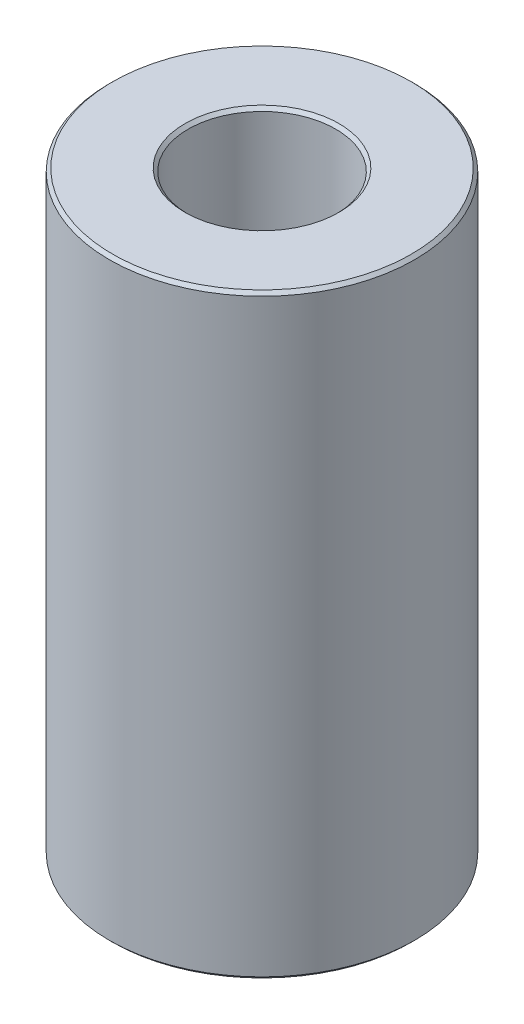
from build123d import *

# Parameters (mm, degrees)
SKETCH1_R           = 45
BOSS_EXTRUDE1_DEPTH = 175.735483215
SKETCH2_R           = 21.760932669
CUT_EXTRUDE1_DEPTH  = 187.903611684
CHAMFER1_SIZE       = 0.946063948


with BuildPart() as part:
    # Sketch1 → Boss-Extrude1 (new body)
    with BuildSketch(Plane(origin=(0, 0, 0), x_dir=(1, 0, 0), z_dir=(0, 1, 0))):
        Circle(SKETCH1_R)
    extrude(amount=BOSS_EXTRUDE1_DEPTH)

    # Sketch2 → Cut-Extrude1 (cut, through all)
    with BuildSketch(Plane(origin=(0, 0, 0), x_dir=(1, 0, 0), z_dir=(0, 1, 0))):
        Circle(SKETCH2_R)
    extrude(amount=CUT_EXTRUDE1_DEPTH, mode=Mode.SUBTRACT)

    # Chamfer1
    chamfer1_edges = [part.edges().sort_by_distance(p)[0] for p in [
        (-21.760932669, 175.735483215, 0),
        (-21.760932669, 0, 0),
        (-45, 0, 0),
        (-45, 175.735483215, 0),
    ]]
    chamfer(chamfer1_edges, length=CHAMFER1_SIZE)


solid = part.part
